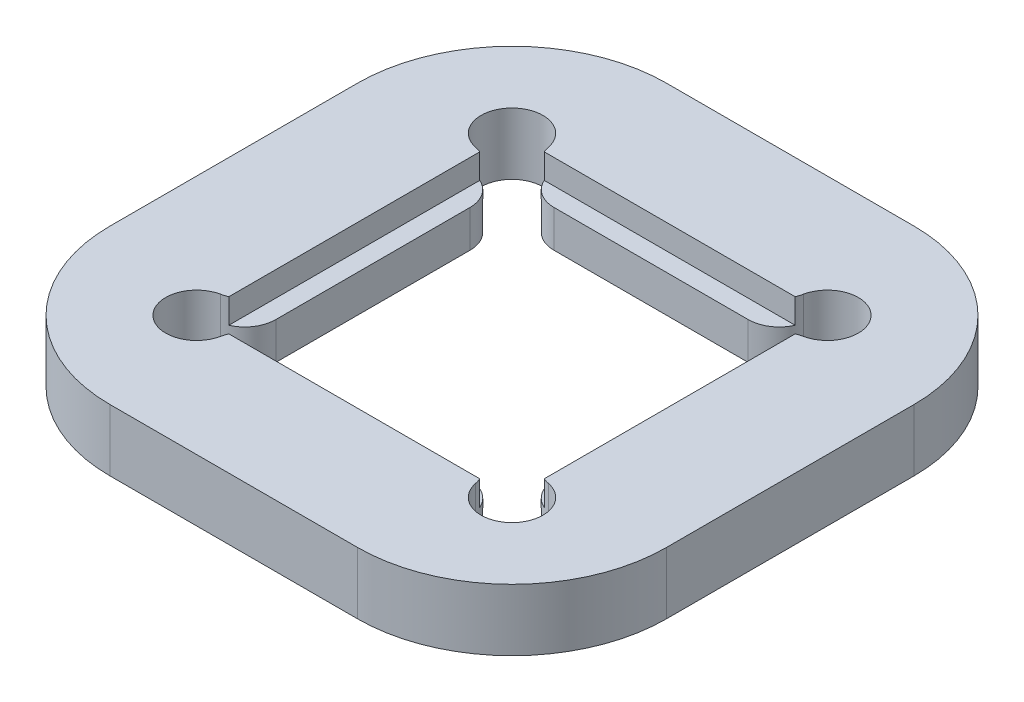
from build123d import *
from build123d.topology import SkipClean

# Parameters (mm, degrees)
CROQUIS1_W              = 90
CROQUIS1_H              = 90
SALIENTE_EXTRUIR1_DEPTH = 10
CROQUIS2_W              = 51
CROQUIS2_H              = 51
CORTAR_EXTRUIR1_DEPTH   = 4
CROQUIS3_W              = 45
CROQUIS3_H              = 45
CORTAR_EXTRUIR2_DEPTH   = 128.42056349
CROQUIS4_R              = 5
CORTAR_EXTRUIR3_DEPTH   = 128.671453348
REDONDEO1_R             = 5
REDONDEO2_R             = 25


with BuildPart() as part:
    # Croquis1 → Saliente-Extruir1 (new body)
    with BuildSketch(Plane(origin=(0, 0, 0), x_dir=(1, 0, 0), z_dir=(0, 1, 0))):
        with Locations((45, 45)):
            Rectangle(CROQUIS1_W, CROQUIS1_H)
    extrude(amount=SALIENTE_EXTRUIR1_DEPTH)

    # Croquis2 → Cortar-Extruir1 (cut)
    with BuildSketch(Plane(origin=(0, 10, 0), x_dir=(1, 0, 0), z_dir=(0, 1, 0))):
        with Locations((45, 45)):
            Rectangle(CROQUIS2_W, CROQUIS2_H)
    extrude(amount=-CORTAR_EXTRUIR1_DEPTH, mode=Mode.SUBTRACT)

    # Croquis3 → Cortar-Extruir2 (cut, through all)
    with BuildSketch(Plane(origin=(0, 6, 0), x_dir=(1, 0, 0), z_dir=(0, 1, 0))):
        with Locations((45, 45)):
            Rectangle(CROQUIS3_W, CROQUIS3_H)
    extrude(amount=-CORTAR_EXTRUIR2_DEPTH, mode=Mode.SUBTRACT)

    # Croquis4 → Cortar-Extruir3 (cut, through all)
    with SkipClean():  # the faces are left unmerged after this step: merging them gives an invalid solid
        with BuildSketch(Plane(origin=(0, 10, 0), x_dir=(1, 0, 0), z_dir=(0, 1, 0))):
            with Locations((19.5, 70.5)):
                Circle(CROQUIS4_R)
            with Locations((70.5, 70.5)):
                Circle(CROQUIS4_R)
            with Locations((19.5, 19.5)):
                Circle(CROQUIS4_R)
            with Locations((70.5, 19.5)):
                Circle(CROQUIS4_R)
        extrude(amount=-CORTAR_EXTRUIR3_DEPTH, mode=Mode.SUBTRACT)
    add(part.part.scale(1), mode=Mode.REPLACE)  # the faces are merged on a copy

    # Redondeo1
    redondeo1_edges = [part.edges().sort_by_distance(p)[0] for p in [
        (23.5, 3, -67.5),
        (22.5, 3, -66.5),
        (67.5, 3, -66.5),
        (66.5, 3, -67.5),
        (22.5, 3, -23.5),
        (23.5, 3, -22.5),
        (66.5, 3, -22.5),
        (67.5, 3, -23.5),
    ]]
    fillet(redondeo1_edges, radius=REDONDEO1_R)

    # Redondeo2
    redondeo2_edges = [part.edges().sort_by_distance(p)[0] for p in [
        (90, 5, -90),
        (90, 5, 0),
        (0, 5, 0),
        (0, 5, -90),
    ]]
    fillet(redondeo2_edges, radius=REDONDEO2_R)


solid = part.part
